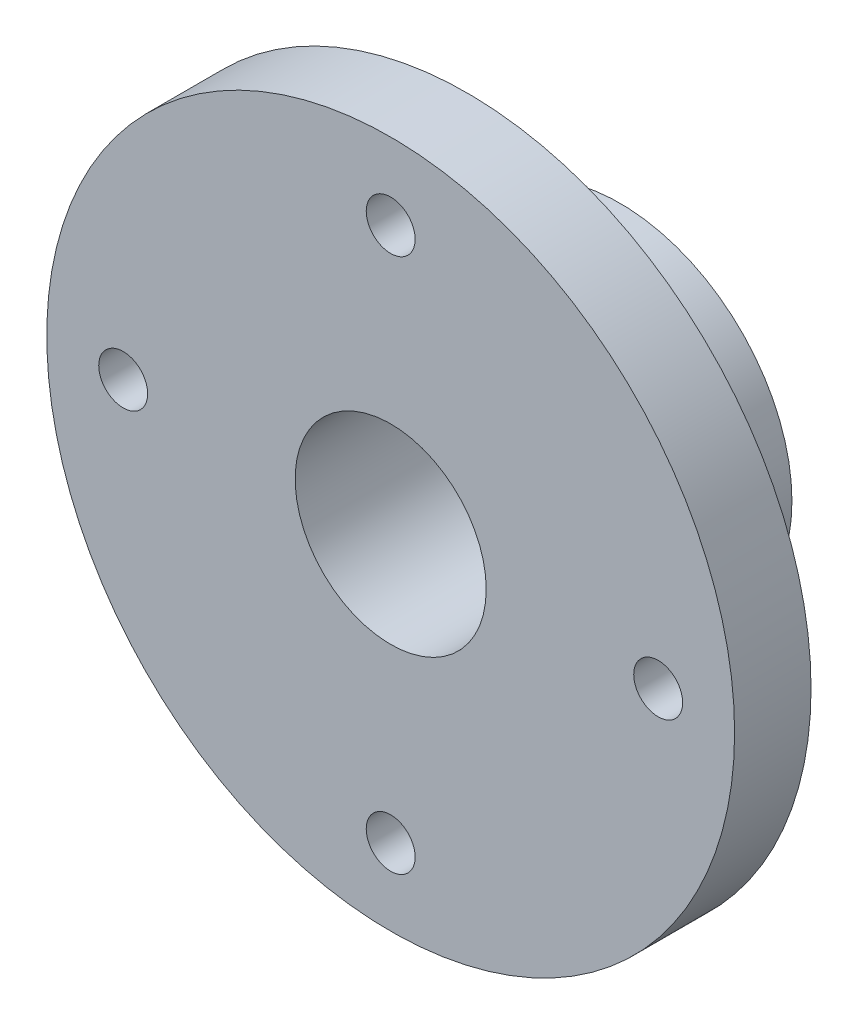
from build123d import *

# Parameters (mm, degrees)
SKETCH1_R                              = 22.5
SKETCH1_R_2                            = 12.5
BOSS_EXTRUDE1_DEPTH                    = 20
BOSS_EXTRUDE2_START                    = 10
SKETCH2_R                              = 45
SKETCH2_R_2                            = 12.5
BOSS_EXTRUDE2_DEPTH                    = 10
CUT_EXTRUDE1_START                     = 11
CUT_EXTRUDE1_DEPTH                     = 4.842719182
CUT_EXTRUDE1_START_2                   = -21
CUT_EXTRUDE1_2_DEPTH                   = 18.000002419
CUT_EXTRUDE1_START_3                   = 15.842719282
CUT_EXTRUDE1_3_DEPTH                   = 1.157280718
CBORE_FOR_M6_HEX_HEAD_BOLT1_AT_2_COUNT = 2
CBORE_FOR_M6_HEX_HEAD_BOLT1_AT_2_PITCH = 49.497474683
CBORE_FOR_M6_HEX_HEAD_BOLT1_AT_3_COUNT = 2
CBORE_FOR_M6_HEX_HEAD_BOLT1_AT_3_PITCH = 70
CBORE_FOR_M6_HEX_HEAD_BOLT1_AT_4_COUNT = 2
CBORE_FOR_M6_HEX_HEAD_BOLT1_AT_4_PITCH = 49.497474683


with BuildPart() as part:
    # Sketch1 → Boss-Extrude1 (new body)
    with BuildSketch(Plane.XY):
        Circle(SKETCH1_R)
        Circle(SKETCH1_R_2, mode=Mode.SUBTRACT)
    extrude(amount=-BOSS_EXTRUDE1_DEPTH)

    # Sketch2 → Boss-Extrude2 (add)
    with BuildSketch(Plane.XY.offset(BOSS_EXTRUDE2_START)):
        Circle(SKETCH2_R)
        Circle(SKETCH2_R_2, mode=Mode.SUBTRACT)
    extrude(amount=-BOSS_EXTRUDE2_DEPTH)

    # Cut-Extrude1: read off the stored shape, not the designer's step
    # Cut-Extrude1 outline → Cut-Extrude1 (cut)
    with BuildSketch(Plane(origin=(0, 0, 0), x_dir=(1, 0, 0), z_dir=(0, 1, 0)).offset(CUT_EXTRUDE1_START)):
        with BuildLine():
            add(Edge.make_bspline(
                [(4, 7), (4.000000645, 5.935618893), (3.56110042, 4.904383726), (2.096294231, 3.439297629), (1.055347946, 3.001083541), (-1.047099738, 2.998915861), (-2.090363581, 3.433909578), (-3.564946099, 4.907687175), (-4, 5.935522054), (-4, 6.999997575)],
                knots=[0, 0, 0, 0, 0.25, 0.25, 0.5, 0.5, 0.75, 0.75, 1, 1, 1, 1], degree=3))
            Line((4, 7), (4, 20))
            Line((4, 20), (-4, 20))
            Line((-4, 20), (-4, 6.999997575))
        make_face()
    extrude(amount=CUT_EXTRUDE1_DEPTH, mode=Mode.SUBTRACT)

    # Cut-Extrude1 2 outline → Cut-Extrude1 2 (cut)
    with BuildSketch(Plane.XY.offset(CUT_EXTRUDE1_START_2)):
        with BuildLine():
            Line((-4, 15.842719282), (4, 15.842719282))
            ThreePointArc((4, 15.842719282), (0, 16.5), (-4, 15.842719282))
        make_face()
    extrude(amount=CUT_EXTRUDE1_2_DEPTH, mode=Mode.SUBTRACT)

    # Cut-Extrude1 3 outline → Cut-Extrude1 3 (add)
    with BuildSketch(Plane(origin=(0, 0, 0), x_dir=(1, 0, 0), z_dir=(0, 1, 0)).offset(CUT_EXTRUDE1_START_3)):
        with BuildLine():
            Line((-4, 2.999997581), (0.000204294, 2.999997681))
            add(Edge.make_bspline(
                [(0.000204294, 2.999997681), (-1.049692709, 2.999997676), (-2.091279995, 3.434825492), (-3.564946099, 4.907687175), (-4, 5.935522054), (-4, 6.999997575)],
                knots=[0.500310737, 0.500310737, 0.500310737, 0.500310737, 0.75, 0.75, 1, 1, 1, 1], degree=3))
            Line((-4, 6.999997575), (-4, 2.999997581))
        make_face()
        with BuildLine():
            add(Edge.make_bspline(
                [(4, 7), (4.000000645, 5.935618893), (3.56110042, 4.904383726), (2.096294231, 3.439297629), (1.055347946, 3.001083541), (0.002817488, 2.999998354), (0.001510885, 2.999997681), (0.000204294, 2.999997681)],
                knots=[0, 0, 0, 0, 0.25, 0.25, 0.5, 0.5, 0.500310737, 0.500310737, 0.500310737, 0.500310737], degree=3))
            Line((0.000204294, 2.999997681), (4, 2.999997581))
            Line((4, 2.999997581), (4, 7))
        make_face()
    extrude(amount=CUT_EXTRUDE1_3_DEPTH)

    # Sketch5 → CBORE for M6 Hex Head Bolt1 (revolve, cut)
    with BuildSketch(Plane.YZ.offset(35)):
        Polygon((0, 0), (0, 10), (3.2, 10), (3.2, 4.38), (7.275, 4.38), (7.275, 0.025), (7.3, 0), align=None)
    cbore_for_m6_hex_head_bolt1 = revolve(axis=Axis((35, 0, -6.35), (0, 0, 1)), mode=Mode.SUBTRACT)

    # CBORE for M6 Hex Head Bolt1 at 2: CBORE for M6 Hex Head Bolt1 ×2
    with Locations(*[Vector(-0.7071067811865277, 0.7071067811865673, 0) * (i * CBORE_FOR_M6_HEX_HEAD_BOLT1_AT_2_PITCH) for i in range(1, CBORE_FOR_M6_HEX_HEAD_BOLT1_AT_2_COUNT)]):
        add(cbore_for_m6_hex_head_bolt1, mode=Mode.SUBTRACT)

    # CBORE for M6 Hex Head Bolt1 at 3: CBORE for M6 Hex Head Bolt1 ×2
    with Locations(*[(-i * CBORE_FOR_M6_HEX_HEAD_BOLT1_AT_3_PITCH, 0, 0) for i in range(1, CBORE_FOR_M6_HEX_HEAD_BOLT1_AT_3_COUNT)]):
        add(cbore_for_m6_hex_head_bolt1, mode=Mode.SUBTRACT)

    # CBORE for M6 Hex Head Bolt1 at 4: CBORE for M6 Hex Head Bolt1 ×2
    with Locations(*[Vector(-0.7071067811865674, -0.7071067811865276, 0) * (i * CBORE_FOR_M6_HEX_HEAD_BOLT1_AT_4_PITCH) for i in range(1, CBORE_FOR_M6_HEX_HEAD_BOLT1_AT_4_COUNT)]):
        add(cbore_for_m6_hex_head_bolt1, mode=Mode.SUBTRACT)


solid = part.part
